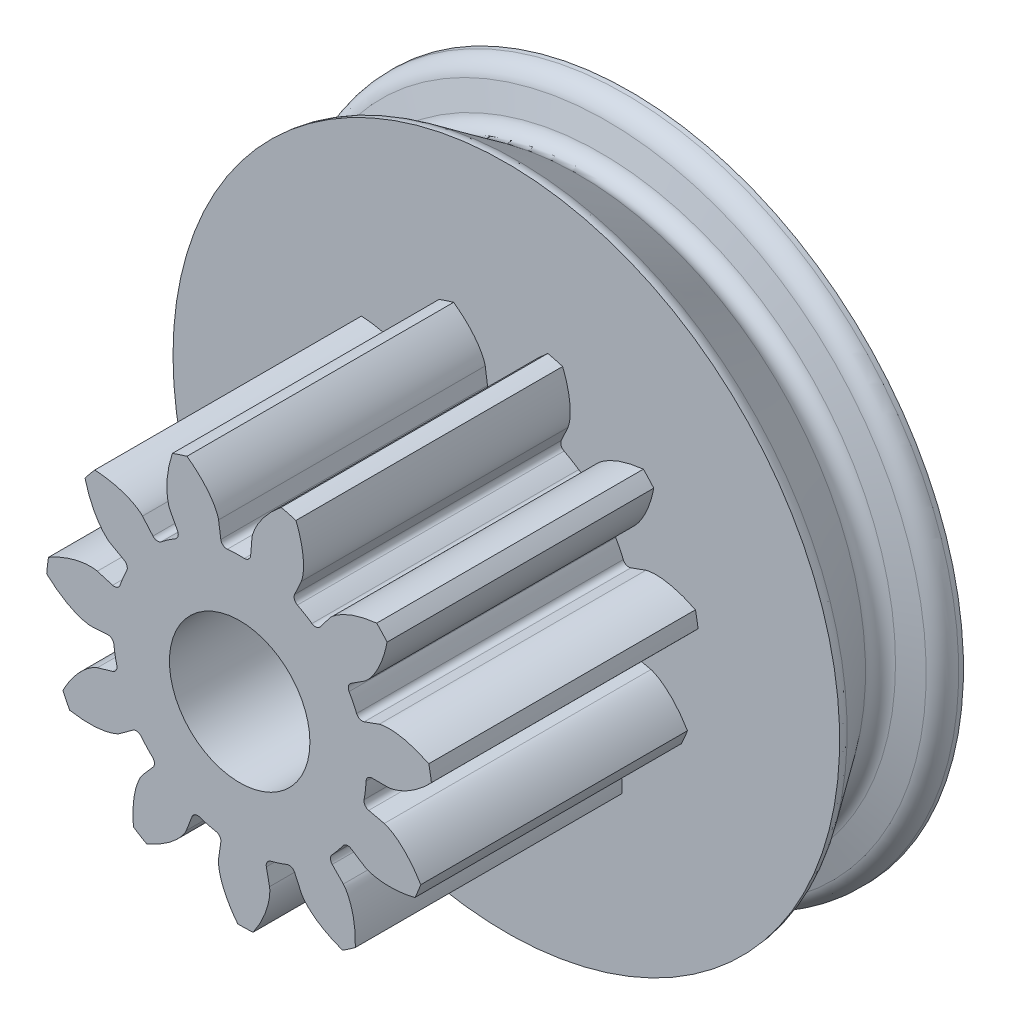
from build123d import *

# Parameters (mm, degrees)
SKETCH2_R                = 8.125
BOSS_EXTRUDE1_DEPTH      = 11.2
CUT_EXTRUDE1_DEPTH       = 11.2
FILLET1_R                = 0.254
CIRPATTERN3_COUNT        = 11
FILLET1_OF_CIRPATTERN3_R = 0.254
SKETCH5_R                = 2.95
CUT_EXTRUDE2_DEPTH       = 26.709142452
FILLET2_R                = 1


# Read off the part's stored shape, not the designer's step: Cut-Extrude1
with BuildPart() as part:
    # Sketch2 → Boss-Extrude1 (new body)
    with BuildSketch(Plane.XY):
        Circle(SKETCH2_R)
    extrude(amount=BOSS_EXTRUDE1_DEPTH)

    # Cut-Extrude1 outline → Cut-Extrude1 (cut)
    with BuildSketch(Plane.XY):
        with BuildLine():
            add(Edge.make_bspline(
                [(7.607545512, -2.853222087), (7.585961851, -2.816586512), (7.539496877, -2.739587861), (7.467150286, -2.627069476), (7.362402195, -2.47489246), (7.249903621, -2.326214012), (7.130345817, -2.180659561), (7.007019369, -2.044472173), (6.89348265, -1.930243975), (6.792538275, -1.837438569), (6.70594293, -1.76345785), (6.632775091, -1.70483954), (6.557676253, -1.648585909), (6.48063417, -1.595104105), (6.401619963, -1.544689589), (6.327243484, -1.501722811), (6.258072281, -1.465782317), (6.198134032, -1.438135242), (6.150959182, -1.418802542), (6.113306658, -1.405476679), (6.089923505, -1.398300886), (6.077399235, -1.395116172), (6.072908509, -1.39408529)],
                knots=[0.279209104, 0.279209104, 0.279209104, 0.279209104, 0.279209104, 0.328394301, 0.383126635, 0.43785898, 0.492591256, 0.547323565, 0.602055884, 0.652783571, 0.680149903, 0.707515961, 0.734882063, 0.762248421, 0.789614741, 0.816980391, 0.844236067, 0.862480777, 0.880559096, 0.894007228, 0.903714168, 0.909090916, 0.909090916, 0.909090916, 0.909090916, 0.909090916], degree=4))
            ThreePointArc((7.607545512, -2.853222087), (8.07334194, -0.914754021), (8.053063977, 1.078788946))
            add(Edge.make_bspline(
                [(6.230866036, 0), (6.235473566, 0), (6.248392879, 0.000301816), (6.272788752, 0.002063982), (6.312468264, 0.006627701), (6.362772665, 0.014915466), (6.427377148, 0.028451165), (6.502836081, 0.04800427), (6.584940383, 0.073240914), (6.673231189, 0.104698853), (6.760286137, 0.139587561), (6.846067267, 0.177612608), (6.93049542, 0.218374425), (7.031447847, 0.271104951), (7.150597351, 0.338972511), (7.28681308, 0.424902383), (7.437483479, 0.530044423), (7.586576545, 0.645159253), (7.729488298, 0.764898307), (7.865628813, 0.88978132), (7.961316066, 0.983260547), (8.023830686, 1.04791121), (8.053063977, 1.078788946)],
                knots=[0, 0, 0, 0, 0, 0.005376748, 0.015083688, 0.02853182, 0.046610139, 0.064854849, 0.092110525, 0.119476175, 0.146842495, 0.174208853, 0.201574955, 0.228941013, 0.256307345, 0.307035032, 0.361767351, 0.41649966, 0.471231936, 0.525964281, 0.580696615, 0.629881812, 0.629881812, 0.629881812, 0.629881812, 0.629881812], degree=4))
            Line((6.230866036, 0), (5.3125, 0))
            ThreePointArc((5.3125, 0), (5.278723576, -0.598108398), (5.1778238, -1.188611352))
            Line((5.1778238, -1.188611352), (6.072908509, -1.39408529))
        make_face()
    cut_extrude1 = extrude(amount=CUT_EXTRUDE1_DEPTH, mode=Mode.SUBTRACT)

    # Fillet1
    fillet1_edges = [part.edges().sort_by_distance(p)[0] for p in [
        (5.1778238, -1.188611352, 5.6),
        (5.3125, 0, 5.6),
    ]]
    fillet(fillet1_edges, radius=FILLET1_R)

    # CirPattern3: Cut-Extrude1 ×11 about axis
    cirpattern3_axis = Axis((0, 0, 55), (0, 0, -1))
    for i in range(1, CIRPATTERN3_COUNT):
        add(cut_extrude1.rotate(cirpattern3_axis, i * 360 / CIRPATTERN3_COUNT), mode=Mode.SUBTRACT)

    # Fillet1 of CirPattern3
    fillet1_of_cirpattern3_edges = [part.edges().sort_by_distance(p)[0] for p in [
        (3.713250751, -3.799266391, 5.6),
        (4.469159393, -2.872154343, 5.6),
        (1.069746825, -5.203681195, 5.6),
        (2.206892257, -4.832419975, 5.6),
        (-1.913394159, -4.955963987, 5.6),
        (-0.756047578, -5.25842641, 5.6),
        (-4.289046017, -3.134763231, 5.6),
        (-3.478947649, -4.014919614, 5.6),
        (-5.30295607, -0.318297297, 5.6),
        (-5.097306422, -1.496704208, 5.6),
        (-4.633215039, 2.599225779, 5.6),
        (-5.097306422, 1.496704208, 5.6),
        (-2.492460971, 4.691513035, 5.6),
        (-3.478947649, 4.014919614, 5.6),
        (0.439631846, 5.294278052, 5.6),
        (-0.756047578, 5.25842641, 5.6),
        (3.232144657, 4.216147195, 5.6),
        (2.206892257, 4.832419975, 5.6),
        (4.998474377, 1.799419393, 5.6),
        (4.469159393, 2.872154343, 5.6),
    ]]
    fillet(fillet1_of_cirpattern3_edges, radius=FILLET1_OF_CIRPATTERN3_R)

    # Sketch4 → Revolve1 (revolve)
    with BuildSketch(Plane(origin=(0, 0, 0), x_dir=(1, 0, 0), z_dir=(0, 1, 0))):
        with BuildLine():
            Line((0, 0), (-14, 0))
            ThreePointArc((-14, 0), (-13.962973561, 0.24056464), (-13.855321635, 0.458861149))
            Line((-13.855321635, 0.458861149), (-12.054190239, 3.031143363))
            ThreePointArc((-12.054190239, 3.031143363), (-11.981865893, 3.580501311), (-12.390390039, 3.95484472))
            Line((-12.390390039, 3.95484472), (-13.407055236, 4.227259339))
            ThreePointArc((-13.407055236, 4.227259339), (-13.834682672, 4.512990857), (-14, 5))
            Line((-14, 5), (-14, 5.2))
            Line((-14, 5.2), (0, 5.2))
            Line((0, 5.2), (0, 5))
            Line((0, 5), (0, 0))
        make_face()
    revolve(axis=Axis((0, 0, -5), (0, 0, 1)))

    # Sketch5 → Cut-Extrude2 (cut, through all)
    with BuildSketch(Plane.XY.offset(11.2)):
        Circle(SKETCH5_R)
    extrude(amount=-CUT_EXTRUDE2_DEPTH, mode=Mode.SUBTRACT)

    # Fillet2
    fillet2_edges = [part.edges().sort_by_distance(p)[0] for p in [
        (-2.95, 0, -5.2),
    ]]
    fillet(fillet2_edges, radius=FILLET2_R)


solid = part.part
